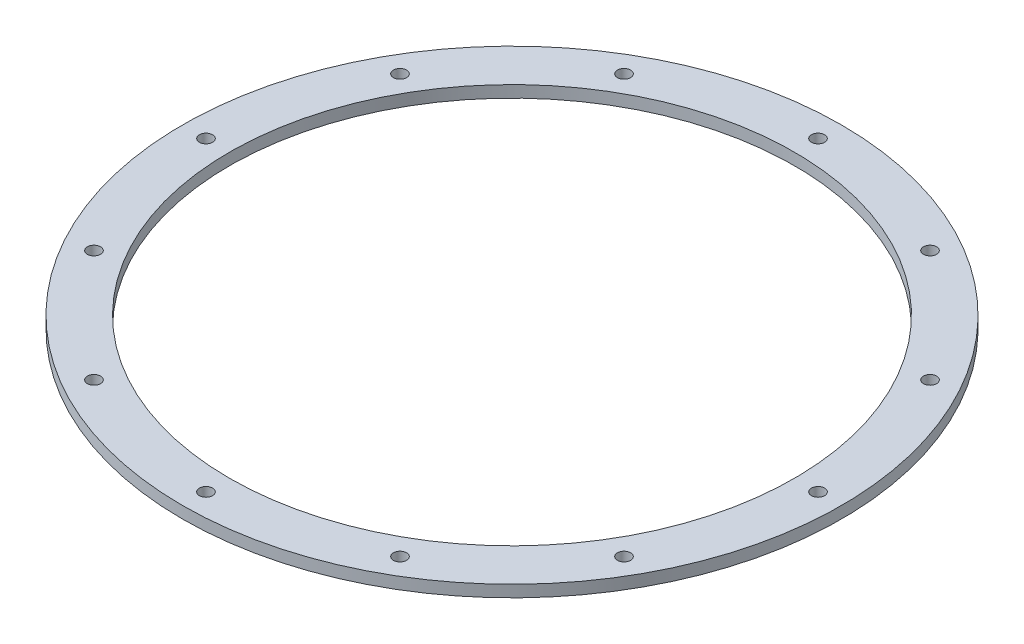
from build123d import *

# Parameters (mm, degrees)
SKETCH1_W                  = 6.35
SKETCH1_H                  = 1.5875
F_50_0_07_DIAMETER_HOLE1_D = 1.778
SCREW_PASSTHROUGHS_COUNT   = 12


with BuildPart() as part:
    # Sketch1 → Main (revolve)
    with BuildSketch(Plane.XY):
        with Locations((-41.275, 0.79375)):
            Rectangle(SKETCH1_W, SKETCH1_H)
    revolve(axis=Axis((0, 55, 0), (0, -1, 0)))

    # #50 (0.07) Diameter Hole1 (through all)
    with Locations(Plane(origin=(0, 0, 0), x_dir=(-1, 0, 0), z_dir=(0, -1, 0))):
        with Locations((41.275, 0)):
            f_50_0_07_diameter_hole1 = Hole(F_50_0_07_DIAMETER_HOLE1_D / 2)

    # Screw Passthroughs: #50 (0.07) Diameter Hole1 ×12 about axis
    screw_passthroughs_axis = Axis((0, 55, 0), (0, -1, 0))
    for i in range(1, SCREW_PASSTHROUGHS_COUNT):
        add(f_50_0_07_diameter_hole1.rotate(screw_passthroughs_axis, i * 360 / SCREW_PASSTHROUGHS_COUNT), mode=Mode.SUBTRACT)


solid = part.part
